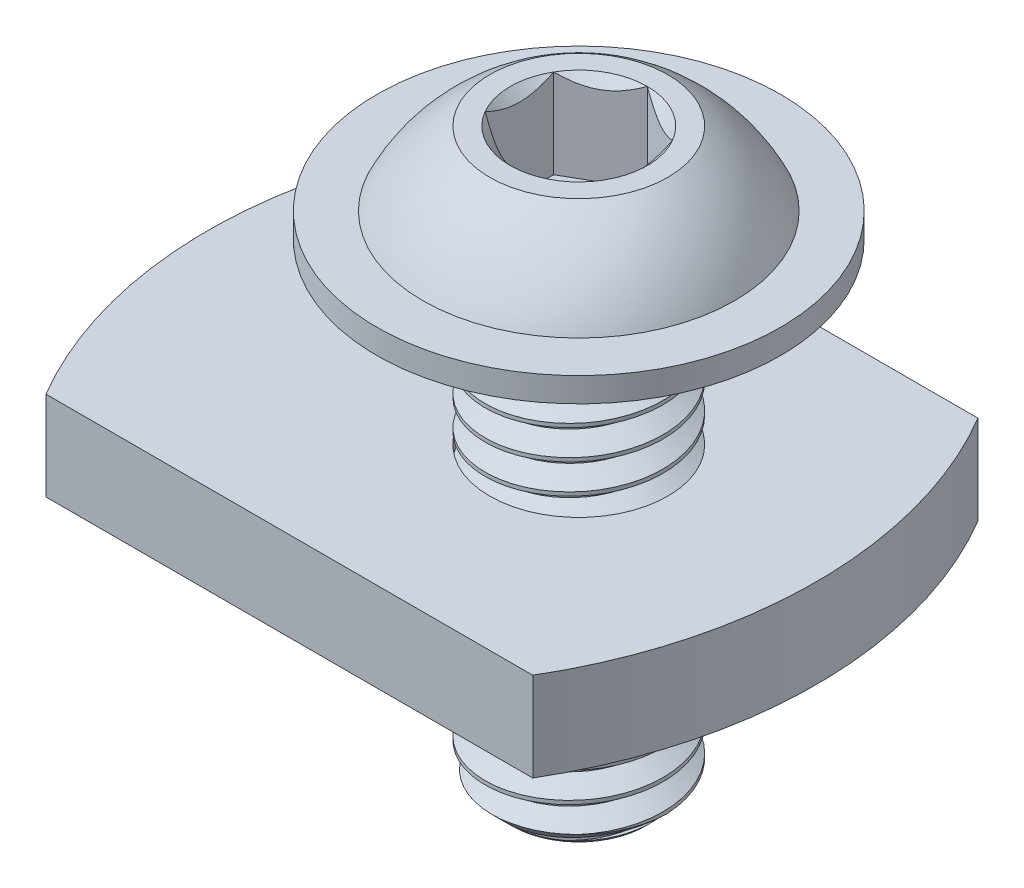
from build123d import *

# Parameters (mm, degrees)
SKETCH1_R           = 3
BOSS_EXTRUDE1_DEPTH = 16
CUT_EXTRUDE2_DEPTH  = 3
BOSS_EXTRUDE2_START = -6
SKETCH8_R           = 3
BOSS_EXTRUDE2_DEPTH = 3
SKETCH9_R           = 3.5
SKETCH9_R_2         = 3
BOSS_EXTRUDE3_DEPTH = 1
CHAMFER1_SIZE       = 0.75
CUT_SWEEP1_PITCH    = 1


with BuildPart() as part:
    # Sketch1 → Boss-Extrude1 (new body)
    with BuildSketch(Plane(origin=(0, 0, 0), x_dir=(1, 0, 0), z_dir=(0, 1, 0))):
        with Locations(Location((0, 0, 0), (0, 0, 270))):
            Circle(SKETCH1_R)
    extrude(amount=-BOSS_EXTRUDE1_DEPTH)

    # Sketch5 → Revolve1 (revolve)
    with BuildSketch(Plane.XY, mode=Mode.PRIVATE) as revolve1_sk:
        with BuildLine():
            Line((0, 0), (0, 3.3))
            Line((0, 3.3), (-3, 3.3))
            ThreePointArc((-3, 3.3), (-4.306626435, 2.227614941), (-5.25, 0.825))
            Line((-5.25, 0.825), (-6.8, 0.825))
            Line((-6.8, 0.825), (-6.8, 0))
            Line((-6.8, 0), (0, 0))
        make_face()
    revolve(revolve1_sk.sketch.rotate(Axis((0, 0, 0), (0, 1, 0)), 180), axis=Axis((0, 0, 0), (0, 1, 0)))

    # Sketch6 → Cut-Extrude2 (cut)
    with BuildSketch(Plane(origin=(0, 3.3, 0), x_dir=(1, 0, 0), z_dir=(0, 1, 0))):
        Polygon((0, 2.309401077), (-2, 1.154700538), (-2, -1.154700538), (0, -2.309401077), (2, -1.154700538), (2, 1.154700538), align=None)
    extrude(amount=-CUT_EXTRUDE2_DEPTH, mode=Mode.SUBTRACT)

    # Cut-Extrude3 cone 1 section (through the dimple's axis) → Cut-Extrude3 (revolve, cut)
    with BuildSketch(Plane(origin=(0, 3.3, 0), x_dir=(0, 0, 1), z_dir=(1, 0, 0))):
        Polygon((0, 0), (2.309401077, 0), (0, 2.309401077), align=None)
    revolve(axis=Axis((0, 3.3, 0), (0, -1, 0)), mode=Mode.SUBTRACT)

    # Chamfer1
    chamfer1_edges = [part.edges().sort_by_distance(p)[0] for p in [
        (0, -16, -3),
    ]]
    chamfer(chamfer1_edges, length=CHAMFER1_SIZE)

    # Cut-Sweep1: the profile of Sketch3 screwed along a right-hand helix of 17 turns, 8 arcs to a turn; built about Z, then put on its axis
    cut_sweep1_z = Axis((0, 0, 0), (0, 0, 1))
    cut_sweep1_corners = [(2.350480947, 0, -0.375), (3.054126588, 0, 0.03125), (3.054126588, 0, -0.90625), (2.350480947, 0, -0.5)]
    with BuildLine(mode=Mode.PRIVATE) as cut_sweep1_profile:
        Line(cut_sweep1_corners[0], cut_sweep1_corners[1])
        Line(cut_sweep1_corners[1], cut_sweep1_corners[2])
        Line(cut_sweep1_corners[2], cut_sweep1_corners[3])
        Line(cut_sweep1_corners[3], cut_sweep1_corners[0])
    cut_sweep1_cap = Face(cut_sweep1_profile.wire())
    cut_sweep1_turn_angles = [0, 22.5, 45, 67.5, 90, 112.5, 135, 157.5, 180, 202.5, 225, 247.5, 270, 292.5, 315, 337.5, 360]
    cut_sweep1_turn_weights = [1, 0.9238795325112867, 1, 0.9238795325112867, 1, 0.9238795325112867, 1, 0.9238795325112867, 1, 0.9238795325112867, 1, 0.9238795325112867, 1, 0.9238795325112867, 1, 0.9238795325112867, 1]
    cut_sweep1_turn_rails = [Edge.make_bspline([Vector(p[0], p[1], 0).rotate(cut_sweep1_z, cut_sweep1_turn_angles[k]) / cut_sweep1_turn_weights[k] + Vector(0, 0, p[2] + CUT_SWEEP1_PITCH * cut_sweep1_turn_angles[k] / 360) for k in range(17)], [0, 0, 0, 1, 1, 2, 2, 3, 3, 4, 4, 5, 5, 6, 6, 7, 7, 8, 8, 8], 2, cut_sweep1_turn_weights) for p in cut_sweep1_corners]
    cut_sweep1_turn_sides = [Face.make_surface_from_curves(cut_sweep1_turn_rails[p[0]], cut_sweep1_turn_rails[p[1]]) for p in [(0, 1), (1, 2), (2, 3), (3, 0)]]
    cut_sweep1 = Plane(origin=(0, -16, 0), x_dir=(0, 0, -1), z_dir=(0, 1, 0)) * Solid(Shell([*[p.moved(Location((0, 0, CUT_SWEEP1_PITCH * i))) for i in range(17) for p in cut_sweep1_turn_sides], cut_sweep1_cap, cut_sweep1_cap.rotate(cut_sweep1_z, 6120).moved(Location((0, 0, CUT_SWEEP1_PITCH * 6120 / 360)))]))
    add(cut_sweep1, mode=Mode.SUBTRACT)


with BuildPart() as body_2:
    # Sketch8 → Boss-Extrude2 (new body)
    with BuildSketch(Plane(origin=(0, 0, 0), x_dir=(1, 0, 0), z_dir=(0, 1, 0)).offset(BOSS_EXTRUDE2_START)):
        with BuildLine():
            Line((-10.45, 7.5), (5.95, 7.5))
            ThreePointArc((5.95, 7.5), (8, 0), (5.95, -7.5))
            Line((5.95, -7.5), (-10.45, -7.5))
            ThreePointArc((-10.45, -7.5), (-12.5, 0), (-10.45, 7.5))
        make_face()
        with Locations(Location((0, 0, 0), (0, 0, 270))):
            Circle(SKETCH8_R, mode=Mode.SUBTRACT)
    extrude(amount=-BOSS_EXTRUDE2_DEPTH)

    # Sketch9 → Boss-Extrude3 (add)
    with BuildSketch(Plane.XZ.offset(9)):
        with Locations(Location((0, 0, 0), (0, 0, 90))):
            Circle(SKETCH9_R)
        with Locations(Location((0, 0, 0), (0, 0, 90))):
            Circle(SKETCH9_R_2, mode=Mode.SUBTRACT)
    extrude(amount=BOSS_EXTRUDE3_DEPTH)


solid = Compound([part.part, body_2.part])
